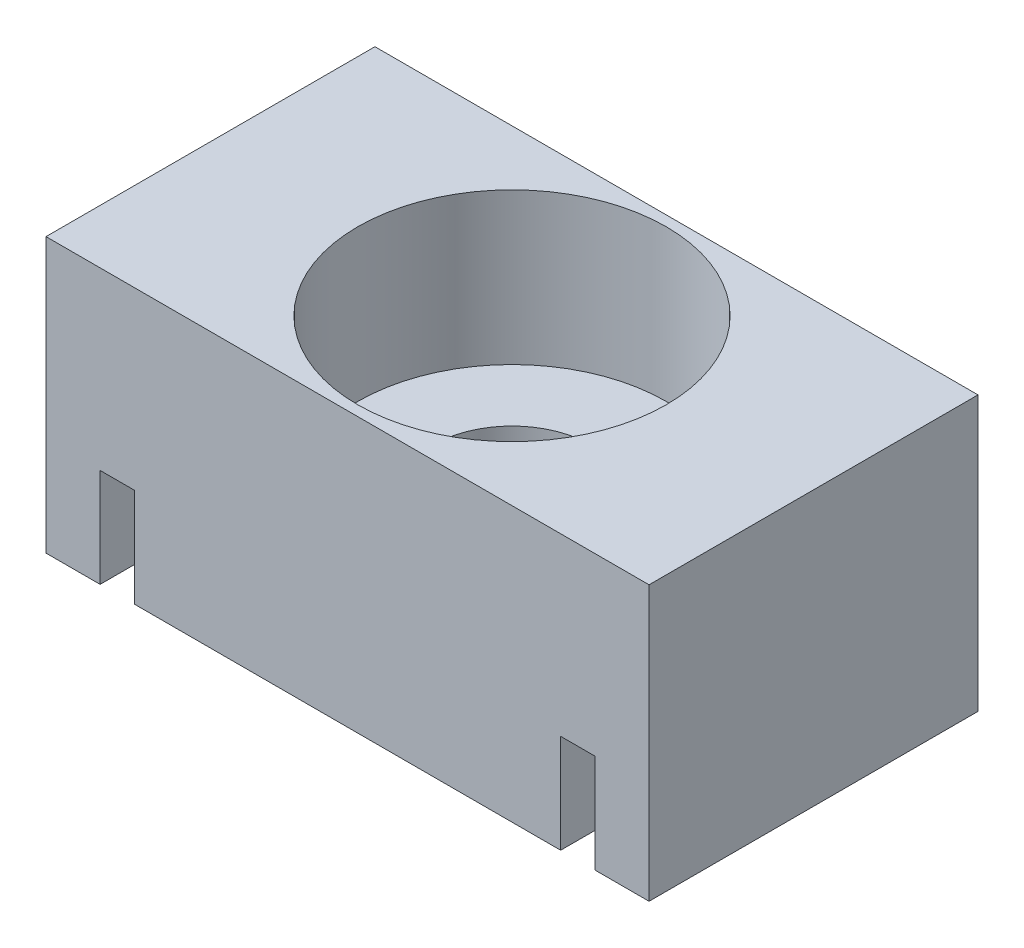
from build123d import *

# Parameters (mm, degrees)
SKETCH1_W               = 13.97
SKETCH1_H               = 7.62
BASE_DEPTH              = 6.35
BOXSLOTS_DEPTH          = 2.286
MOUTINGHOLE_D           = 3.6576
MOUTINGHOLE_CBORE_D     = 7.14502
MOUTINGHOLE_CBORE_DEPTH = 3.5052


with BuildPart() as part:
    # Sketch1 → Base (new body)
    with BuildSketch(Plane(origin=(0, 0, 0), x_dir=(1, 0, 0), z_dir=(0, 1, 0))):
        Rectangle(SKETCH1_W, SKETCH1_H)
    extrude(amount=BASE_DEPTH)

    # Sketch2 → BoxSlots (cut)
    with BuildSketch(Plane.XZ):
        with BuildLine():
            Line((-4.937125, 3.81), (-4.937125, 2.3368))
            ThreePointArc((-4.937125, 2.3368), (-5.334, 1.939925), (-5.730875, 2.3368))
            Line((-5.730875, 2.3368), (-5.730875, 3.81))
            ThreePointArc((-5.730875, 3.81), (-5.334, 4.206875), (-4.937125, 3.81))
        make_face()
        with BuildLine():
            Line((5.730875, 3.81), (5.730875, 2.3368))
            ThreePointArc((5.730875, 2.3368), (5.334, 1.939925), (4.937125, 2.3368))
            Line((4.937125, 2.3368), (4.937125, 3.81))
            ThreePointArc((4.937125, 3.81), (5.334, 4.206875), (5.730875, 3.81))
        make_face()
    extrude(amount=-BOXSLOTS_DEPTH, mode=Mode.SUBTRACT)

    # MoutingHole (through all)
    with Locations(Plane(origin=(0, 6.35, 0), x_dir=(1, 0, 0), z_dir=(0, 1, 0))):
        with Locations((0, 0)):
            CounterBoreHole(MOUTINGHOLE_D / 2, MOUTINGHOLE_CBORE_D / 2, MOUTINGHOLE_CBORE_DEPTH)


solid = part.part
